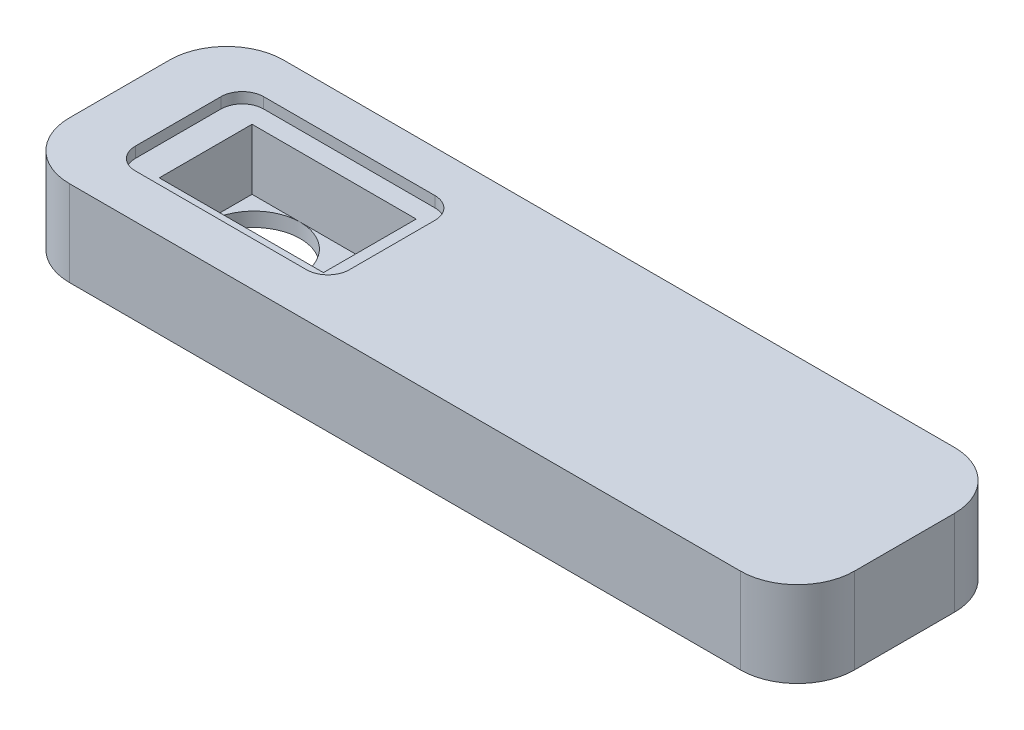
from build123d import *

# Parameters (mm, degrees)
SKETCH1_W           = 110
SKETCH1_H           = 30
BOSS_EXTRUDE1_DEPTH = 12
FILLET2_R           = 8
SKETCH4_R           = 6.5
CUT_EXTRUDE1_DEPTH  = 67.870108383
SKETCH3_W           = 23
SKETCH3_H           = 13
CUT_EXTRUDE2_DEPTH  = 10
SKETCH5_W           = 30
SKETCH5_H           = 18
CUT_EXTRUDE3_DEPTH  = 1.5
FILLET4_R           = 3


with BuildPart() as part:
    # Sketch1 → Boss-Extrude1 (new body)
    with BuildSketch(Plane(origin=(0, 0, 0), x_dir=(1, 0, 0), z_dir=(0, 1, 0))):
        with Locations((8.243243243, 3.108108108)):
            Rectangle(SKETCH1_W, SKETCH1_H)
    extrude(amount=BOSS_EXTRUDE1_DEPTH)

    # Fillet2
    fillet2_edges = [part.edges().sort_by_distance(p)[0] for p in [
        (63.243243243, 6, -18.108108108),
        (63.243243243, 6, 11.891891892),
        (-46.756756757, 6, -18.108108108),
        (-46.756756757, 6, 11.891891892),
    ]]
    fillet(fillet2_edges, radius=FILLET2_R)

    # Sketch4 → Cut-Extrude1 (cut, through all)
    with BuildSketch(Plane(origin=(0, 12, 0), x_dir=(1, 0, 0), z_dir=(0, 1, 0))):
        with Locations((-27.929103529, 3.108108108)):
            Circle(SKETCH4_R)
    extrude(amount=-CUT_EXTRUDE1_DEPTH, mode=Mode.SUBTRACT)

    # Sketch3 → Cut-Extrude2 (cut)
    with BuildSketch(Plane(origin=(0, 12, 0), x_dir=(1, 0, 0), z_dir=(0, 1, 0))):
        with Locations((-23.179103529, 3.108108108)):
            Rectangle(SKETCH3_W, SKETCH3_H)
    extrude(amount=-CUT_EXTRUDE2_DEPTH, mode=Mode.SUBTRACT)

    # Sketch5 → Cut-Extrude3 (cut)
    with BuildSketch(Plane(origin=(0, 12, 0), x_dir=(1, 0, 0), z_dir=(0, 1, 0))):
        with Locations((-23.708960951, 3.273133416)):
            Rectangle(SKETCH5_W, SKETCH5_H)
    extrude(amount=-CUT_EXTRUDE3_DEPTH, mode=Mode.SUBTRACT)

    # Fillet4
    fillet4_edges = [part.edges().sort_by_distance(p)[0] for p in [
        (-38.708960951, 11.25, 5.726866584),
        (-8.708960951, 11.25, 5.726866584),
        (-38.708960951, 11.25, -12.273133416),
        (-8.708960951, 11.25, -12.273133416),
    ]]
    fillet(fillet4_edges, radius=FILLET4_R)


solid = part.part
